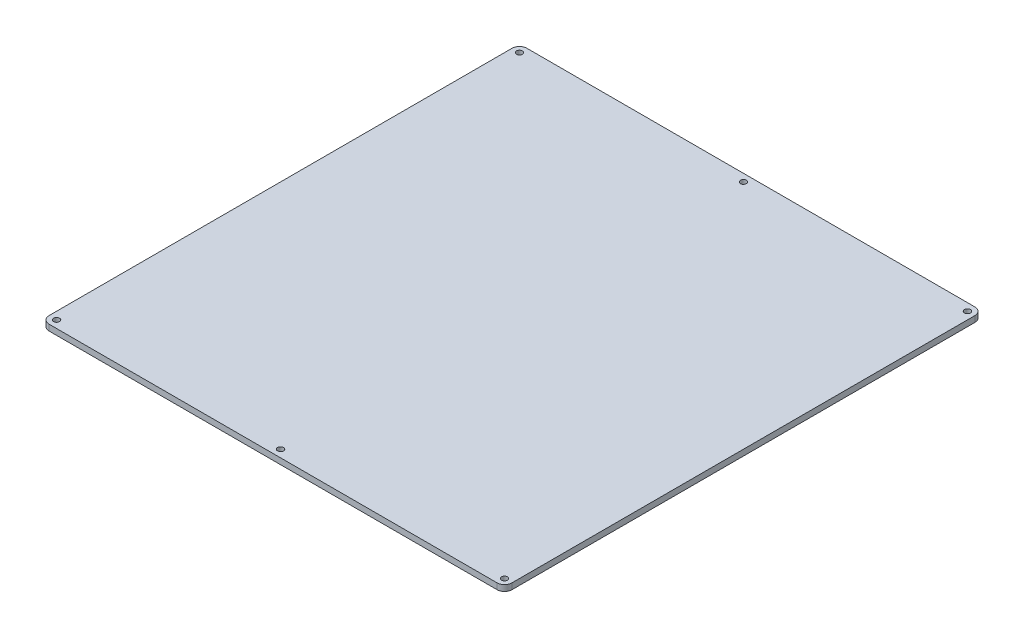
from build123d import *

# Parameters (mm, degrees)
SKETCH1_R           = 2
BOSS_EXTRUDE1_DEPTH = 4


with BuildPart() as part:
    # Sketch1 → Boss-Extrude1 (new body)
    with BuildSketch(Plane(origin=(0, 0, 0), x_dir=(1, 0, 0), z_dir=(0, 1, 0))):
        with BuildLine():
            Line((-155, 310), (-155, 0))
            ThreePointArc((-155, 0), (-153.535533906, -3.535533906), (-150, -5))
            Line((-150, -5), (150, -5))
            ThreePointArc((150, -5), (153.535533906, -3.535533906), (155, 0))
            Line((155, 0), (155, 310))
            ThreePointArc((155, 310), (153.535533906, 313.535533906), (150, 315))
            Line((150, 315), (-150, 315))
            ThreePointArc((-150, 315), (-153.535533906, 313.535533906), (-155, 310))
        make_face()
        with Locations((-150, 310)):
            Circle(SKETCH1_R, mode=Mode.SUBTRACT)
        with Locations((0, 310)):
            Circle(SKETCH1_R, mode=Mode.SUBTRACT)
        with Locations((150, 310)):
            Circle(SKETCH1_R, mode=Mode.SUBTRACT)
        with Locations((-150, 0)):
            Circle(SKETCH1_R, mode=Mode.SUBTRACT)
        Circle(SKETCH1_R, mode=Mode.SUBTRACT)
        with Locations((150, 0)):
            Circle(SKETCH1_R, mode=Mode.SUBTRACT)
    extrude(amount=BOSS_EXTRUDE1_DEPTH)


solid = part.part
